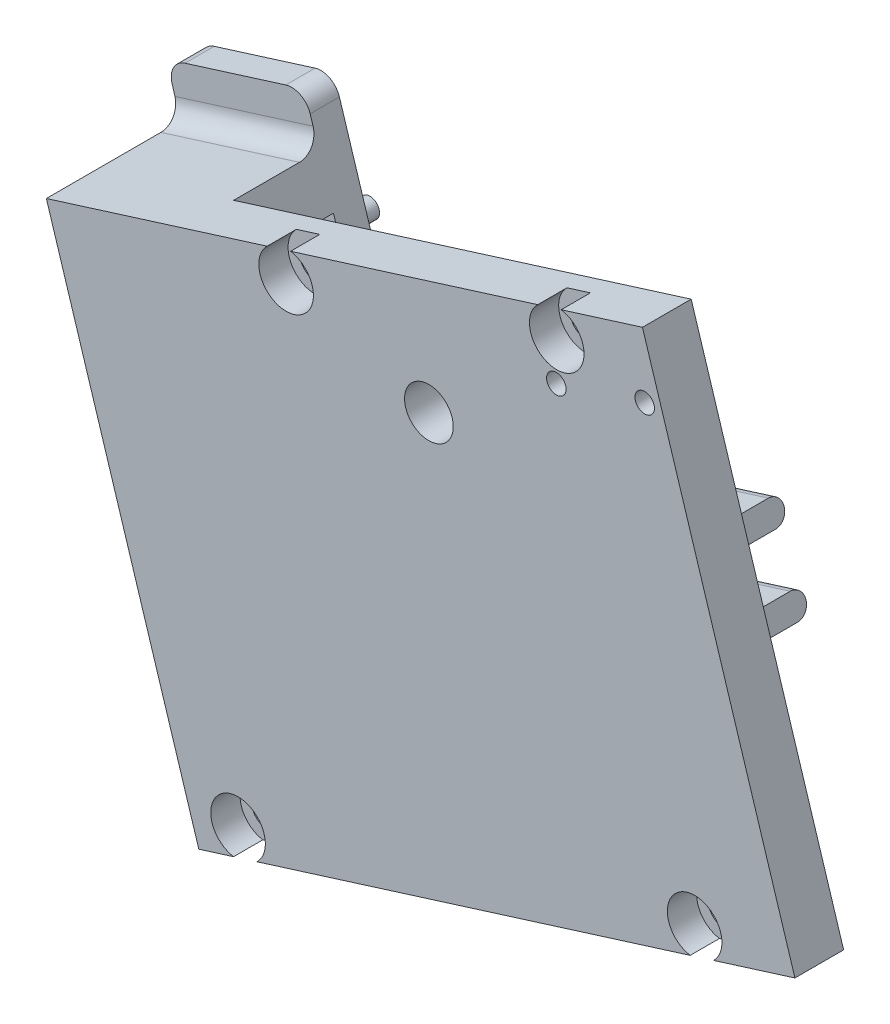
from build123d import *

# Parameters (mm, degrees)
BOSS_EXTRUDE1_DEPTH    = 5
BOSS_EXTRUDE3_DEPTH    = 11.75
BOSS_EXTRUDE5_DEPTH    = 3
FILLET1_R              = 2
BOSS_EXTRUDE6_DEPTH    = 10
SKETCH7_R              = 2
CUT_EXTRUDE1_DEPTH     = 96.909253568
BOSS_EXTRUDE8_DEPTH    = 3
FILLET4_R              = 2.5
FILLET5_R              = 1.25
CUT_EXTRUDE2_OUTLINE_R = 1.6
CUT_EXTRUDE2_DEPTH     = 5
SKETCH10_R             = 2.5
CUT_EXTRUDE3_DEPTH     = 110.504432364
SKETCH4_R              = 1
BOSS_EXTRUDE4_DEPTH    = 6
SKETCH12_R             = 2.8
CUT_EXTRUDE4_DEPTH     = 3
SKETCH9_R              = 1
CUT_EXTRUDE5_DEPTH     = 111.58128552


# Read off the part's stored shape, not the designer's step: Cut-Extrude2
# Some blends are built 0.0001 mm under size
with BuildPart() as part:
    # Sketch1 → Boss-Extrude1 (new body)
    with BuildSketch(Plane.XY):
        Polygon((21.227605409, -18.590227349), (16.764409011, -4.324804639), (31.175545422, 0.183980935), (77.940160264, 14.815139421), (93.586541992, -35.194367063), (32.410790739, -54.334311124), align=None)
    extrude(amount=BOSS_EXTRUDE1_DEPTH)

    # Sketch3 → Boss-Extrude3 (add)
    with BuildSketch(Plane(origin=(0, 0, 0), x_dir=(-1, 0, 0), z_dir=(0, 0, -1))):
        Polygon((-30.984669443, 0.124261921), (-32.477644799, -4.647637553), (-23.029283841, -7.603728757), (-25.939785869, -16.906376014), (-21.167886395, -18.39935137), (-16.764409011, -4.324804639), align=None)
    extrude(amount=BOSS_EXTRUDE3_DEPTH)

    # Sketch5 → Boss-Extrude5 (add)
    with BuildSketch(Plane(origin=(0, 0, -11.75), x_dir=(-1, 0, 0), z_dir=(0, 0, -1))):
        with BuildLine():
            Line((-30.984669443, 0.124261921), (-29.491694087, 4.896161395))
            Line((-29.491694087, 4.896161395), (-27.773810277, 4.358690267))
            Line((-27.773810277, 4.358690267), (-17.237837952, 1.062320107))
            ThreePointArc((-17.237837952, 1.062320107), (-16.072415286, 0.098650836), (-15.914708528, -1.405342859))
            Line((-15.914708528, -1.405342859), (-16.764409011, -4.324804639))
            Line((-16.764409011, -4.324804639), (-30.984669443, 0.124261921))
        make_face()
    extrude(amount=-BOSS_EXTRUDE5_DEPTH)

    # Fillet1
    fillet1_edges = [part.edges().sort_by_distance(p)[0] for p in [
        (23.874539227, -2.100271359, -8.75),
        (29.491694087, 4.896161395, -10.25),
    ]]
    fillet(fillet1_edges, radius=FILLET1_R)

    # Sketch6 → Boss-Extrude6 (add)
    with BuildSketch(Plane(origin=(0, 0, 0), x_dir=(-1, 0, 0), z_dir=(0, 0, -1))):
        Polygon((-77.85901424, -10.043127118), (-29.090201618, -25.301335253), (-28.34371394, -22.915385516), (-77.112526562, -7.657177381), align=None)
        Polygon((-79.351989595, -14.815026591), (-80.098477273, -17.200976328), (-31.329664652, -32.459184464), (-30.583176974, -30.073234727), align=None)
    extrude(amount=BOSS_EXTRUDE6_DEPTH)

    # Sketch7 → Cut-Extrude1 (cut, through all)
    with BuildSketch(Plane(origin=(9.057366854, -28.949469231, 0), x_dir=(0.9543798947428422, 0.29859507114257827, 0), z_dir=(-0.2985950711425783, 0.9543798947428423, 0))):
        with Locations(Location((46.758249559, 5, 0), (0, 0, 180))):
            Circle(SKETCH7_R)
        with Locations(Location((59.258249559, 5, 0), (0, 0, 180))):
            Circle(SKETCH7_R)
        with Locations(Location((34.258249559, 5, 0), (0, 0, 180))):
            Circle(SKETCH7_R)
    extrude(amount=-CUT_EXTRUDE1_DEPTH, mode=Mode.SUBTRACT)

    # Sketch11 → Boss-Extrude8 (add)
    with BuildSketch(Plane(origin=(0, 0, -11.75), x_dir=(-1, 0, 0), z_dir=(0, 0, -1))):
        Polygon((-32.477644799, -4.647637553), (-34.866405368, -12.282676711), (-35.388146827, -13.95028481), (-25.939785869, -16.906376014), (-23.029283841, -7.603728757), align=None)
    extrude(amount=-BOSS_EXTRUDE8_DEPTH)

    # Fillet4
    fillet4_edges = [part.edges().sort_by_distance(p)[0] for p in [
        (52.728120251, -15.286281449, 0),
        (53.474607929, -17.672231185, 0),
        (54.967583285, -22.444130659, 0),
        (55.714070963, -24.830080396, 0),
    ]]
    fillet(fillet4_edges, radius=FILLET4_R - 0.0001)  # a hair under: the kernel refuses the full size

    # Fillet5
    # the kernel refuses this fillet: 1.25 mm, written as the material it takes off along each edge
    with BuildSketch(Plane(origin=(83.080914444, -16.267866731, -10), x_dir=(0, 0, 1), z_dir=(-0.9543798947428422, -0.2985950711425782, 0)), Plane(origin=(27.600739803, -31.006344324, -10), x_dir=(0, 0, 1), z_dir=(0.9543798947428423, 0.2985950711425782, 0)), Plane(origin=(25.361276769, -23.848495114, -10), x_dir=(0, 0, 1), z_dir=(0.9543798947428422, 0.2985950711425783, 0)), Plane(origin=(80.841451411, -9.11001752, -10), x_dir=(0, 0, 1), z_dir=(-0.9543798947428422, -0.2985950711425783, 0))) as fillet5_piece_1:
        with BuildLine():
            CenterArc((FILLET5_R, FILLET5_R), FILLET5_R, 180, 90)
            Line((0, FILLET5_R), (0, 0))
            Line((0, 0), (FILLET5_R, 0))
        make_face()
    extrude(amount=57.35, mode=Mode.SUBTRACT)

    # Cut-Extrude2 outline → Cut-Extrude2 (cut)
    with BuildSketch(Plane.XY):
        with Locations((69.142848995, 9.443238973)):
            Circle(CUT_EXTRUDE2_OUTLINE_R)
        with Locations((36.436202535, -50.455386031)):
            Circle(CUT_EXTRUDE2_OUTLINE_R)
        with Locations((41.370394058, 0.754122403)):
            Circle(CUT_EXTRUDE2_OUTLINE_R)
        with Locations((83.296255367, -35.794368038)):
            Circle(CUT_EXTRUDE2_OUTLINE_R)
    extrude(amount=CUT_EXTRUDE2_DEPTH, mode=Mode.SUBTRACT)

    # Sketch10 → Cut-Extrude3 (cut, through all)
    with BuildSketch(Plane.XY.offset(5)):
        with Locations((56.022602403, -3.725145057)):
            Circle(SKETCH10_R)
    extrude(amount=-CUT_EXTRUDE3_DEPTH, mode=Mode.SUBTRACT)

    # Sketch4 → Boss-Extrude4 (add)
    with BuildSketch(Plane(origin=(0, 0, -11.75), x_dir=(-1, 0, 0), z_dir=(0, 0, -1))):
        with Locations((-27.213433721, -11.264996593)):
            Circle(SKETCH4_R)
    extrude(amount=BOSS_EXTRUDE4_DEPTH)

    # Sketch12 → Cut-Extrude4 (cut)
    with BuildSketch(Plane.XY.offset(5)):
        with Locations((69.142848995, 9.443238973)):
            Circle(SKETCH12_R)
        with Locations((41.370394058, 0.754122403)):
            Circle(SKETCH12_R)
        with Locations((36.436202535, -50.455386031)):
            Circle(SKETCH12_R)
        with Locations((83.296255367, -35.794368038)):
            Circle(SKETCH12_R)
    extrude(amount=-CUT_EXTRUDE4_DEPTH, mode=Mode.SUBTRACT)

    # Sketch9 → Cut-Extrude5 (cut, through all)
    with BuildSketch(Plane.XY.offset(5)):
        with Locations((78.168297598, 8.225179053)):
            Circle(SKETCH9_R)
        with Locations((69.101688598, 5.388525877)):
            Circle(SKETCH9_R)
    extrude(amount=-CUT_EXTRUDE5_DEPTH, mode=Mode.SUBTRACT)


solid = part.part
